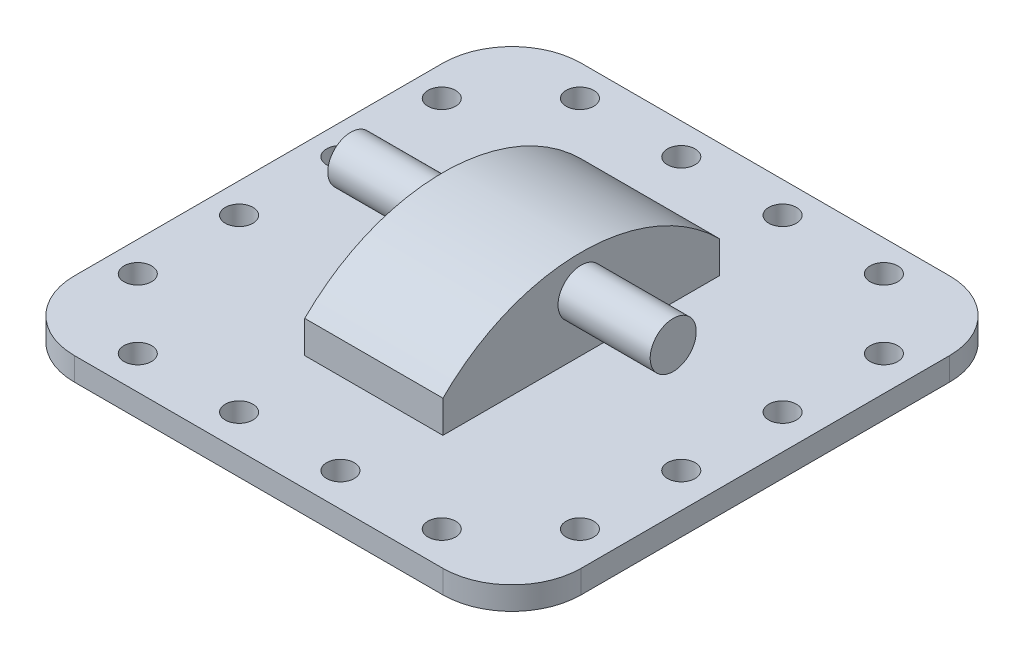
from build123d import *

# Parameters (mm, degrees)
SKETCH1_W                = 110
SKETCH1_H                = 110
BOSS_EXTRUDE1_DEPTH      = 5
FILLET2_R                = 15
FILLET3_R                = 15
FILLET4_R                = 15
FILLET5_R                = 15
SKETCH2_W                = 30
SKETCH2_H                = 60
BOSS_EXTRUDE2_DEPTH      = 24
BOSS_EXTRUDE3_DEPTH      = 20
BOSS_EXTRUDE3_DEPTH_BACK = 50
SKETCH4_R                = 5
FILLET6_R                = 10
FILLET7_R                = 10
SKETCH5_R                = 3
CUT_EXTRUDE2_DEPTH       = 10
CUT_EXTRUDE3_DEPTH       = 60


with BuildPart() as part:
    # Sketch1 → Boss-Extrude1 (new body)
    with BuildSketch(Plane(origin=(0, 0, 0), x_dir=(1, 0, 0), z_dir=(0, 1, 0))):
        Rectangle(SKETCH1_W, SKETCH1_H)
    extrude(amount=BOSS_EXTRUDE1_DEPTH)

    # Fillet2
    fillet2_edges = [part.edges().sort_by_distance(p)[0] for p in [
        (55, 2.5, -55),
    ]]
    fillet(fillet2_edges, radius=FILLET2_R)

    # Fillet3
    fillet3_edges = [part.edges().sort_by_distance(p)[0] for p in [
        (-55, 2.5, -55),
    ]]
    fillet(fillet3_edges, radius=FILLET3_R)

    # Fillet4
    fillet4_edges = [part.edges().sort_by_distance(p)[0] for p in [
        (-55, 2.5, 55),
    ]]
    fillet(fillet4_edges, radius=FILLET4_R)

    # Fillet5
    fillet5_edges = [part.edges().sort_by_distance(p)[0] for p in [
        (55, 2.5, 55),
    ]]
    fillet(fillet5_edges, radius=FILLET5_R)

    # Sketch2 → Boss-Extrude2 (add)
    with BuildSketch(Plane(origin=(0, 5, 0), x_dir=(1, 0, 0), z_dir=(0, 1, 0))):
        Rectangle(SKETCH2_W, SKETCH2_H)
    extrude(amount=BOSS_EXTRUDE2_DEPTH)

    # Sketch4 → Boss-Extrude3 (add, two sides: drawn at the far end of the back side and taken through both)
    with BuildSketch(Plane(origin=(15, 0, 0), x_dir=(0, 0, -1), z_dir=(1, 0, 0)).offset(-BOSS_EXTRUDE3_DEPTH_BACK)):
        with Locations((0, 17)):
            Circle(SKETCH4_R)
    extrude(amount=BOSS_EXTRUDE3_DEPTH + BOSS_EXTRUDE3_DEPTH_BACK)

    # Fillet6
    fillet6_edges = [part.edges().sort_by_distance(p)[0] for p in [
        (0, 29, 30),
    ]]
    fillet(fillet6_edges, radius=FILLET6_R)

    # Fillet7
    fillet7_edges = [part.edges().sort_by_distance(p)[0] for p in [
        (0, 29, -30),
    ]]
    fillet(fillet7_edges, radius=FILLET7_R)

    # Sketch5 → Cut-Extrude2 (cut)
    with BuildSketch(Plane.XZ):
        with Locations((47.497955542, -11.251022229)):
            Circle(SKETCH5_R)
        with Locations((47.497955542, 32.748977771)):
            Circle(SKETCH5_R)
        with Locations((-48.502044458, 10.748977771)):
            Circle(SKETCH5_R)
        with Locations((-48.502044458, -11.251022229)):
            Circle(SKETCH5_R)
        with Locations((-48.502044458, -33.251022229)):
            Circle(SKETCH5_R)
        with Locations((-33.502044458, -48.251022229)):
            Circle(SKETCH5_R)
        with Locations((-11.502044458, -48.251022229)):
            Circle(SKETCH5_R)
        with Locations((10.497955542, -48.251022229)):
            Circle(SKETCH5_R)
        with Locations((32.497955542, -48.251022229)):
            Circle(SKETCH5_R)
        with Locations((47.497955542, -33.251022229)):
            Circle(SKETCH5_R)
        with Locations((47.497955542, 10.748977771)):
            Circle(SKETCH5_R)
        with Locations((32.497955542, 47.748977771)):
            Circle(SKETCH5_R)
        with Locations((10.497955542, 47.748977771)):
            Circle(SKETCH5_R)
        with Locations((-11.502044458, 47.748977771)):
            Circle(SKETCH5_R)
        with Locations((-33.502044458, 47.748977771)):
            Circle(SKETCH5_R)
        with Locations((-48.502044458, 32.748977771)):
            Circle(SKETCH5_R)
    extrude(amount=-CUT_EXTRUDE2_DEPTH, mode=Mode.SUBTRACT)

    # Sketch8 → Cut-Extrude3 (cut)
    with BuildSketch(Plane.ZY.offset(15)):
        with BuildLine():
            Line((-30, 19), (-30, 12))
            ThreePointArc((-30, 12), (0, 24.426406871), (30, 12))
            Line((30, 12), (30, 19))
            ThreePointArc((30, 19), (27.071067812, 26.071067812), (20, 29))
            Line((20, 29), (-20, 29))
            ThreePointArc((-20, 29), (-27.071067812, 26.071067812), (-30, 19))
        make_face()
    extrude(amount=-CUT_EXTRUDE3_DEPTH, mode=Mode.SUBTRACT)


with BuildPart() as body_2:
    # Split1: the piece on the far side of the plane
    add(part.part)
    split(bisect_by=Plane(origin=(0, 5, 0), x_dir=(0, 0, -1), z_dir=(0, -1, 0)), keep=Keep.BOTTOM)


with BuildPart() as part_1:
    add(part.part)

    # Split1
    split(bisect_by=Plane(origin=(0, 5, 0), x_dir=(0, 0, -1), z_dir=(0, -1, 0)), keep=Keep.TOP)


solid = Compound([body_2.part, part_1.part])
